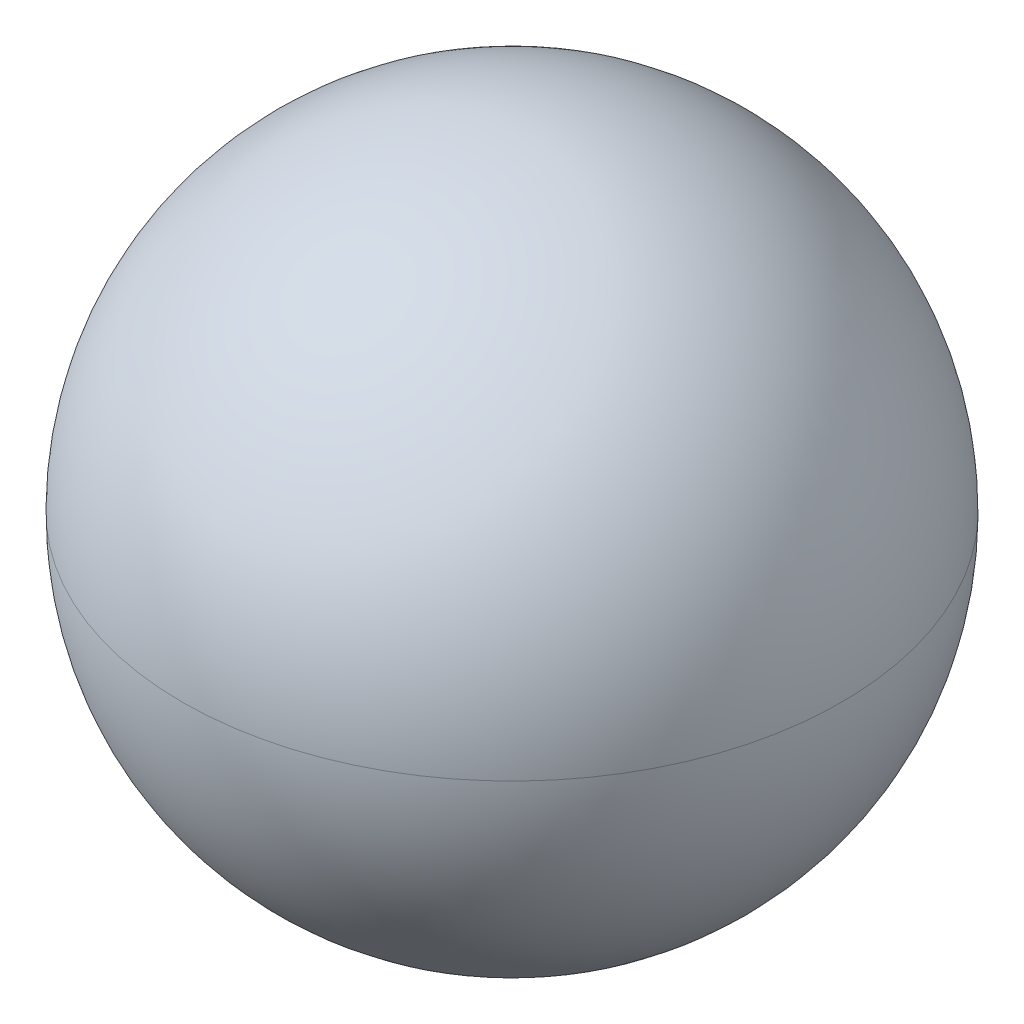
from build123d import *

# Parameters (mm, degrees)
SKETCH1_R           = 381
BOSS_EXTRUDE1_DEPTH = 762
FILLET1_R           = 381
SHELL2_T            = 3.175


with BuildPart() as part:
    # Sketch1 → Boss-Extrude1 (new body)
    with BuildSketch(Plane(origin=(0, 0, 0), x_dir=(1, 0, 0), z_dir=(0, 1, 0))):
        with Locations(Location((0, 0, 0), (0, 0, 270))):
            Circle(SKETCH1_R)
    extrude(amount=BOSS_EXTRUDE1_DEPTH)

    # Fillet1
    fillet1_edges = [part.edges().sort_by_distance(p)[0] for p in [
        (0, 0, -381),
        (0, 762, -381),
    ]]
    fillet(fillet1_edges, radius=FILLET1_R - 0.0001)  # a hair under: the kernel refuses the full size

    # Shell2 (no face opened: a closed hollow body)
    add(offset(amount=-SHELL2_T, mode=Mode.PRIVATE), mode=Mode.SUBTRACT)


solid = part.part
